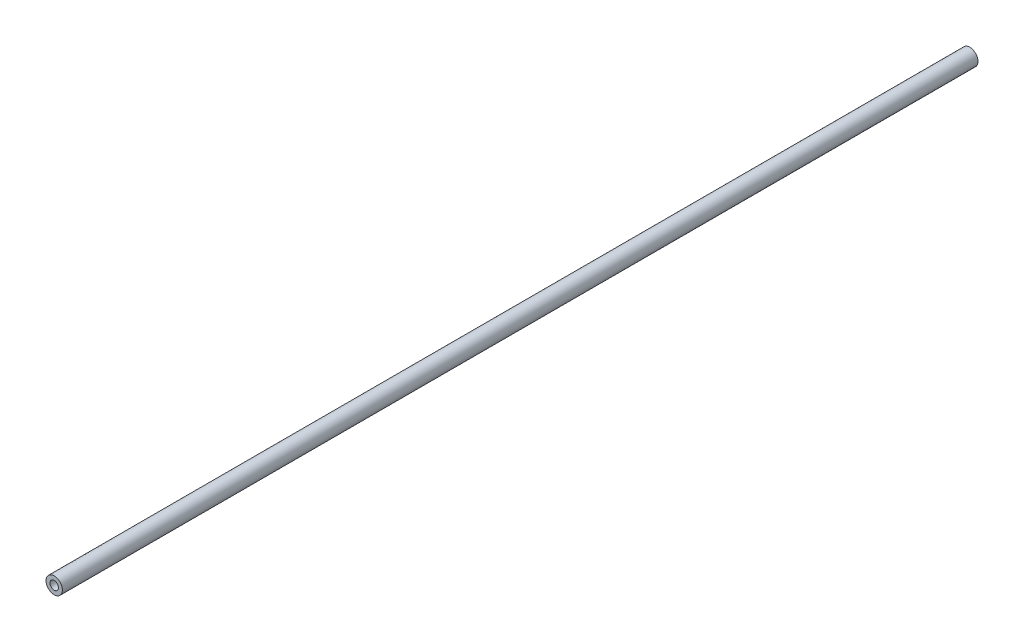
from build123d import *

# Parameters (mm, degrees)
SKETCH1_R                      = 5
BOSS_EXTRUDE1_DEPTH            = 559
F_6_0_204_DIAMETER_HOLE1_D     = 5.1816
F_6_0_204_DIAMETER_HOLE1_DEPTH = 30
F_6_0_204_DIAMETER_HOLE1_TIP   = 1.556709692
F_6_0_204_DIAMETER_HOLE2_D     = 5.1816
F_6_0_204_DIAMETER_HOLE2_DEPTH = 30
F_6_0_204_DIAMETER_HOLE2_TIP   = 1.556709692


with BuildPart() as part:
    # Sketch1 → Boss-Extrude1 (new body)
    with BuildSketch(Plane.XY):
        Circle(SKETCH1_R)
    extrude(amount=BOSS_EXTRUDE1_DEPTH)

    # #6 (0.204) Diameter Hole1
    with Locations(Plane(origin=(0, 0, 0), x_dir=(-1, 0, 0), z_dir=(0, 0, -1))):
        with Locations((0, 0)):
            Hole(F_6_0_204_DIAMETER_HOLE1_D / 2, depth=F_6_0_204_DIAMETER_HOLE1_DEPTH)
            with Locations((0, 0, -(F_6_0_204_DIAMETER_HOLE1_DEPTH + F_6_0_204_DIAMETER_HOLE1_TIP / 2))):  # 118° drill point
                Cone(0, F_6_0_204_DIAMETER_HOLE1_D / 2, F_6_0_204_DIAMETER_HOLE1_TIP, mode=Mode.SUBTRACT)

    # #6 (0.204) Diameter Hole2
    with Locations(Plane.XY.offset(559)):
        with Locations((0, 0)):
            Hole(F_6_0_204_DIAMETER_HOLE2_D / 2, depth=F_6_0_204_DIAMETER_HOLE2_DEPTH)
            with Locations((0, 0, -(F_6_0_204_DIAMETER_HOLE2_DEPTH + F_6_0_204_DIAMETER_HOLE2_TIP / 2))):  # 118° drill point
                Cone(0, F_6_0_204_DIAMETER_HOLE2_D / 2, F_6_0_204_DIAMETER_HOLE2_TIP, mode=Mode.SUBTRACT)


solid = part.part
